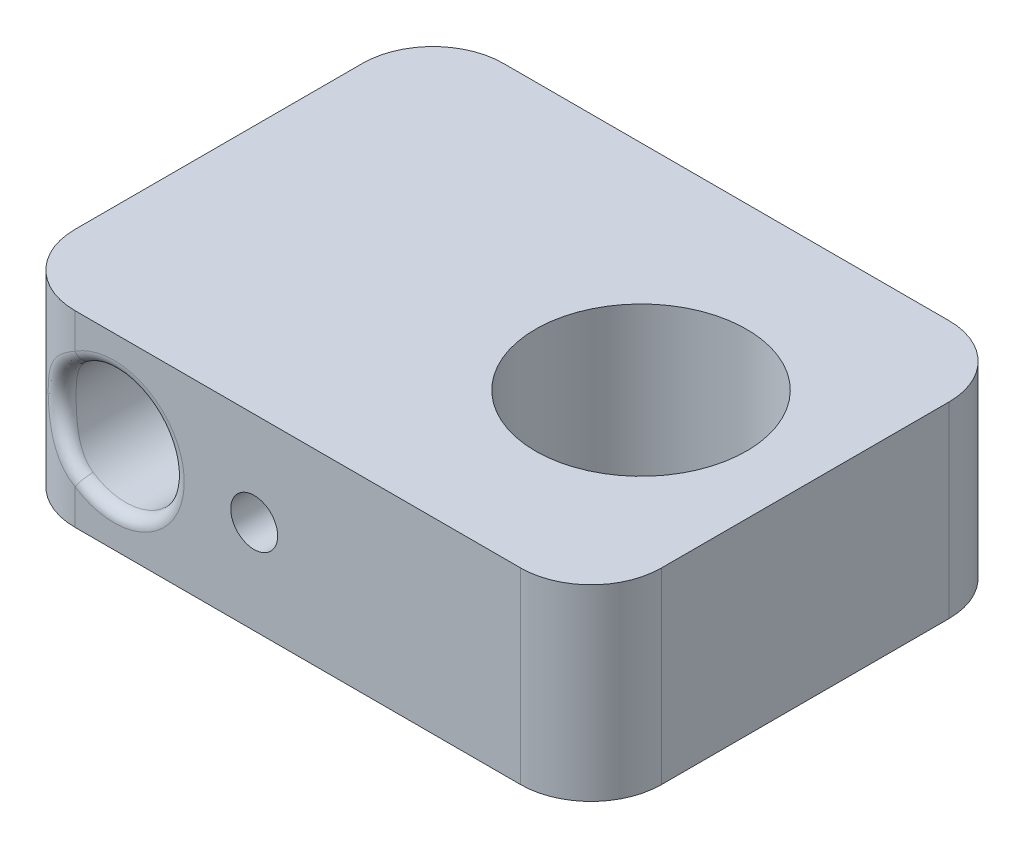
from build123d import *

# Parameters (mm, degrees)
SKETCH1_W                  = 25
SKETCH1_H                  = 18.26
BOSS_EXTRUDE1_DEPTH        = 4
M10X1_0_TAPPED_HOLE1_D     = 9
M10X1_0_TAPPED_HOLE1_DEPTH = 25
M10X1_0_TAPPED_HOLE1_TIP   = 2.703872786
CUT_EXTRUDE1_DEPTH         = 16.987710906
CUT_EXTRUDE1_DEPTH_BACK    = 16.987710906
SKETCH4_R                  = 2.5
SKETCH4_R_2                = 1
FILLET1_R                  = 3
FILLET2_R                  = 0.5


with BuildPart() as part:
    # Sketch1 → Boss-Extrude1 (new, symmetric)
    with BuildSketch(Plane(origin=(0, 0, 0), x_dir=(1, 0, 0), z_dir=(0, 1, 0))):
        Rectangle(SKETCH1_W, SKETCH1_H)
    extrude(amount=BOSS_EXTRUDE1_DEPTH, both=True)

    # M10x1.0 Tapped Hole1
    with Locations(Plane(origin=(0, 4, 0), x_dir=(-1, 0, 0), z_dir=(0, 1, 0))):
        with Locations((-5.5, 0)):
            Hole(M10X1_0_TAPPED_HOLE1_D / 2, depth=M10X1_0_TAPPED_HOLE1_DEPTH)
            with Locations((0, 0, -(M10X1_0_TAPPED_HOLE1_DEPTH + M10X1_0_TAPPED_HOLE1_TIP / 2))):  # 118° drill point
                Cone(0, M10X1_0_TAPPED_HOLE1_D / 2, M10X1_0_TAPPED_HOLE1_TIP, mode=Mode.SUBTRACT)

    # Sketch4 → Cut-Extrude1 (cut, two sides: drawn at the far end of the back side and taken through both)
    with BuildSketch(Plane.XY.offset(-CUT_EXTRUDE1_DEPTH_BACK)):
        with Locations((-7.84, 0)):
            Circle(SKETCH4_R)
        with Locations((-1.86, 0)):
            Circle(SKETCH4_R_2)
    extrude(amount=CUT_EXTRUDE1_DEPTH + CUT_EXTRUDE1_DEPTH_BACK, mode=Mode.SUBTRACT)

    # Fillet1
    # the kernel refuses this fillet: 3 mm, written as the material it takes off along each edge
    with BuildSketch(Plane(origin=(-12.5, -11.5, -9.13), x_dir=(1, 0, 0), z_dir=(0, 1, 0)), Plane(origin=(12.5, 11.5, -9.13), x_dir=(-1, 0, 0), z_dir=(0, -1, 0))) as fillet1_piece_1:
        with BuildLine():
            CenterArc((FILLET1_R, -FILLET1_R), FILLET1_R, 90, 90)
            Line((0, -FILLET1_R), (0, 0))
            Line((0, 0), (FILLET1_R, 0))
        make_face()
    extrude(amount=23, mode=Mode.SUBTRACT)
    with BuildSketch(Plane(origin=(12.5, 11.5, 9.13), x_dir=(-1, 0, 0), z_dir=(0, -1, 0)), Plane(origin=(-12.5, -11.5, 9.13), x_dir=(1, 0, 0), z_dir=(0, 1, 0))) as fillet1_piece_2:
        with BuildLine():
            CenterArc((FILLET1_R, FILLET1_R), FILLET1_R, 180, 90)
            Line((0, FILLET1_R), (0, 0))
            Line((0, 0), (FILLET1_R, 0))
        make_face()
    extrude(amount=23, mode=Mode.SUBTRACT)

    # Fillet2
    fillet2_edges = [part.edges().sort_by_distance(p)[0] for p in [
        (-6.815304923, 2.28035085, -9.13),
        (-6.815304923, -2.28035085, 9.13),
        (-10.34, 0, 9.01),
        (-10.34, 0, -9.01),
    ]]
    fillet(fillet2_edges, radius=FILLET2_R)


solid = part.part
